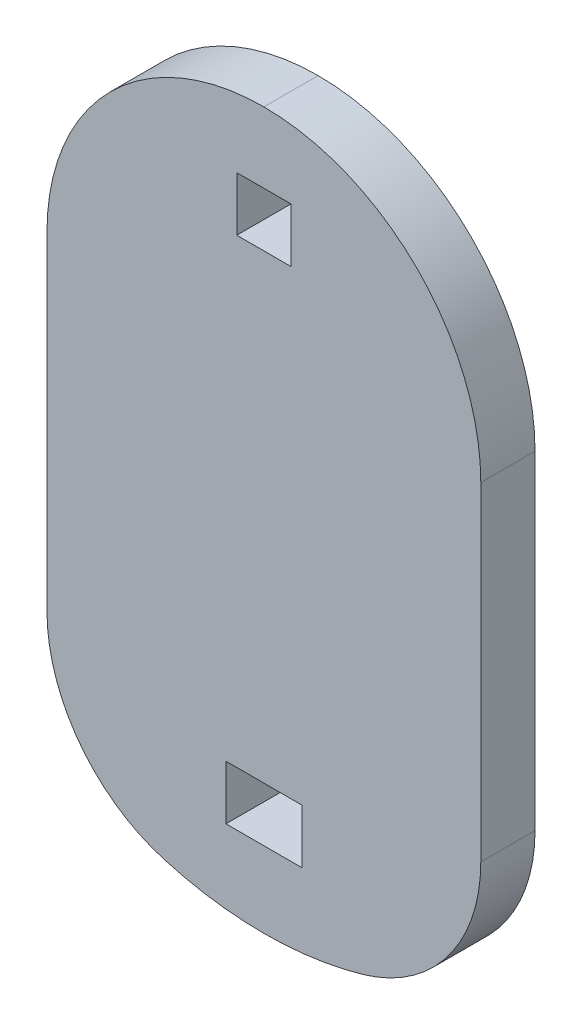
from build123d import *

# Parameters (mm, degrees)
SKETCH1_R           = 33
BOSS_EXTRUDE1_DEPTH = 5
CUT_EXTRUDE3_START  = -10
CUT_EXTRUDE3_DEPTH  = 10
FILLET2_R           = 20
FILLET3_R           = 15
SKETCH7_W           = 5
SKETCH7_H           = 5
SKETCH7_W_2         = 7
CUT_EXTRUDE4_DEPTH  = 10


with BuildPart() as part:
    # Sketch1 → Boss-Extrude1 (new body)
    with BuildSketch(Plane.XY):
        Circle(SKETCH1_R)
    extrude(amount=BOSS_EXTRUDE1_DEPTH)

    # Sketch6 → Cut-Extrude3 (cut)
    with BuildSketch(Plane.XY.offset(5).offset(CUT_EXTRUDE3_START)):
        with BuildLine():
            Line((-20, 26.248809497), (-20, -26.248809497))
            ThreePointArc((-20, -26.248809497), (-33, 0), (-20, 26.248809497))
        make_face()
        with BuildLine():
            Line((20, -26.248809497), (20, 26.248809497))
            ThreePointArc((20, 26.248809497), (33, 0), (20, -26.248809497))
        make_face()
    extrude(amount=CUT_EXTRUDE3_DEPTH, mode=Mode.SUBTRACT)

    # Fillet2
    fillet2_edges = [part.edges().sort_by_distance(p)[0] for p in [
        (-20, 26.248809497, 2.5),
        (20, 26.248809497, 2.5),
    ]]
    fillet(fillet2_edges, radius=FILLET2_R - 0.0001)  # a hair under: the kernel refuses the full size

    # Fillet3
    fillet3_edges = [part.edges().sort_by_distance(p)[0] for p in [
        (-20, -26.248809497, 2.5),
        (20, -26.248809497, 2.5),
    ]]
    fillet(fillet3_edges, radius=FILLET3_R)

    # Sketch7 → Cut-Extrude4 (cut)
    with BuildSketch(Plane.XY.offset(5)):
        with Locations((0, 24)):
            Rectangle(SKETCH7_W, SKETCH7_H)
        with Locations((0, -23.5)):
            Rectangle(SKETCH7_W_2, SKETCH7_H)
    extrude(amount=-CUT_EXTRUDE4_DEPTH, mode=Mode.SUBTRACT)


solid = part.part
